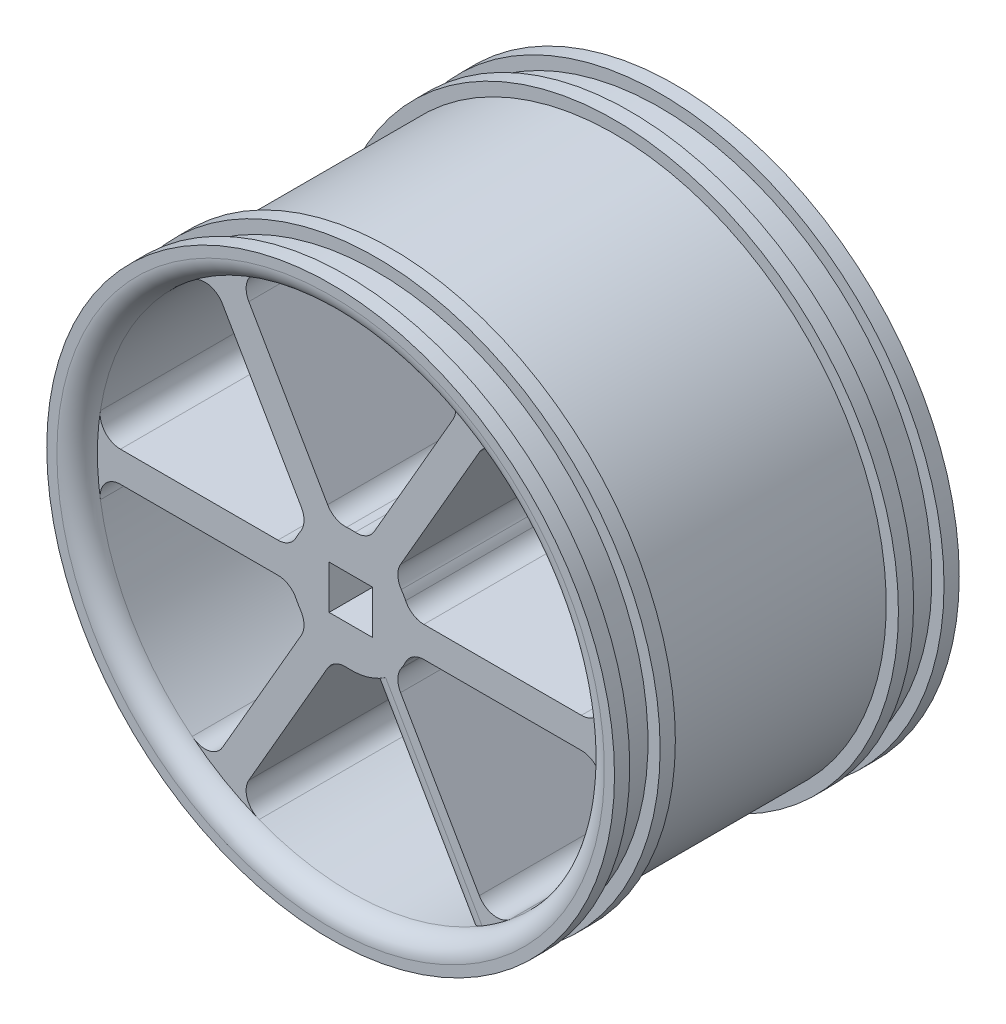
from build123d import *

# Parameters (mm, degrees)
SKETCH2_W           = 25
SKETCH2_H           = 3
BOSS_EXTRUDE1_DEPTH = 32
CIRPATTERN1_COUNT   = 6
SKETCH5_R           = 6
BOSS_EXTRUDE2_DEPTH = 32
SKETCH6_W           = 4.3
SKETCH6_H           = 4.3
AXLEHOLE_DEPTH      = 53.191951405
FILLET1_R           = 2


with BuildPart() as part:
    # Sketch1 → Revolve1 (revolve)
    with BuildSketch(Plane.XZ, mode=Mode.PRIVATE) as revolve1_sk:
        with BuildLine():
            Line((25, 0), (28, 0))
            Line((28, 0), (28, 1.5))
            Line((28, 1.5), (26.8, 1.5))
            Line((26.8, 1.5), (26.8, 4.5))
            Line((26.8, 4.5), (28, 4.5))
            Line((28, 4.5), (28, 6))
            Line((28, 6), (26.8, 6))
            Line((26.8, 6), (26.8, 28))
            Line((26.8, 28), (28, 28))
            Line((28, 28), (28, 29.5))
            Line((28, 29.5), (26.8, 29.5))
            Line((26.8, 29.5), (26.8, 32.5))
            Line((26.8, 32.5), (28, 32.5))
            Line((28, 32.5), (28, 33.999996833))
            Line((28, 33.999996833), (27, 33.999996833))
            ThreePointArc((27, 33.999996833), (25.585786438, 33.414213562), (25, 32))
            Line((25, 32), (25, 0))
        make_face()
    revolve(revolve1_sk.sketch.rotate(Axis((0, 0, 34), (0, 0, -1)), 180), axis=Axis((0, 0, 34), (0, 0, -1)))

    # Sketch2 → Boss-Extrude1 (add)
    with BuildSketch(Plane.XY):
        with Locations((12.5, 0)):
            Rectangle(SKETCH2_W, SKETCH2_H)
    boss_extrude1 = extrude(amount=BOSS_EXTRUDE1_DEPTH)

    # CirPattern1: Boss-Extrude1 ×6 about axis
    cirpattern1_axis = Axis((0, 0, 0), (0, 0, 1))
    for i in range(1, CIRPATTERN1_COUNT):
        add(boss_extrude1.rotate(cirpattern1_axis, i * 360 / CIRPATTERN1_COUNT))

    # Sketch5 → Boss-Extrude2 (add)
    with BuildSketch(Plane.XY):
        Circle(SKETCH5_R)
    extrude(amount=BOSS_EXTRUDE2_DEPTH)

    # Sketch6 → AxleHole (cut, through all)
    with BuildSketch(Plane.XY):
        Rectangle(SKETCH6_W, SKETCH6_H)
    extrude(amount=AXLEHOLE_DEPTH, mode=Mode.SUBTRACT)

    # Fillet1
    # the kernel refuses this fillet: 2 mm, written as the material it adds along each edge
    with BuildSketch(Plane(origin=(-24.954959427, -1.5, 32), x_dir=(0.10620109039764976, -0.9943446728365121, 0), z_dir=(0, 0, -1))) as fillet1_piece_1:
        with BuildLine():
            CenterArc((2.224755634, -1.997850608), FILLET1_R, 87.343441845, 98.752929077)
            Line((0.236066288, -2.210252789), (0, 0))
            ThreePointArc((0, 0), (1.158726893, 0.026867397), (2.317453785, 0))
        make_face()
    extrude(amount=32)
    with BuildSketch(Plane(origin=(-13.776517819, -20.861628814, 32), x_dir=(-0.8080272015953212, 0.589145178612228, 0), z_dir=(0, 0, -1)), Plane(origin=(13.776517819, 20.861628814, 32), x_dir=(0.8080272015953204, -0.589145178612229, 0), z_dir=(0, 0, -1)), Plane(origin=(24.954959427, -1.5, 32), x_dir=(-0.10620109039765001, -0.994344672836512, 0), z_dir=(0, 0, -1)), Plane(origin=(-11.178441608, 22.361628814, 32), x_dir=(0.9142282919929712, 0.405199494224283, 0), z_dir=(0, 0, -1)), Plane(origin=(-24.954959427, 1.5, 32), x_dir=(0.10620109039765026, 0.994344672836512, 0), z_dir=(0, 0, -1))) as fillet1_piece_2:
        with BuildLine():
            CenterArc((2.224755634, 1.997850608), FILLET1_R, 173.903629078, 98.752929077)
            Line((0.236066288, 2.210252789), (0, 0))
            ThreePointArc((0, 0), (1.158726893, -0.026867397), (2.317453785, 0))
        make_face()
    extrude(amount=32)
    with BuildSketch(Plane(origin=(-11.178441608, -22.361628814, 32), x_dir=(0.4999999999999988, 0.8660254037844393, 0), z_dir=(0, 0, -1)), Plane(origin=(13.776517819, -20.861628814, 32), x_dir=(-0.500000000000002, 0.8660254037844375, 0), z_dir=(0, 0, -1)), Plane(origin=(24.954959427, 1.5, 32), x_dir=(-1, 0, 0), z_dir=(0, 0, -1)), Plane(origin=(11.178441608, 22.361628814, 32), x_dir=(-0.5000000000000002, -0.8660254037844387, 0), z_dir=(0, 0, -1)), Plane(origin=(-13.776517819, 20.861628814, 32), x_dir=(0.5000000000000002, -0.8660254037844387, 0), z_dir=(0, 0, -1))) as fillet1_piece_3:
        with BuildLine():
            CenterArc((2.222823584, 2), FILLET1_R, 171.247070923, 98.752929077)
            ThreePointArc((0.246116119, 2.304347826), (0.096342606, 1.15502726), (0, 0))
            Line((0, 0), (2.222823584, 0))
        make_face()
    extrude(amount=32)
    with BuildSketch(Plane(origin=(5.809475019, 1.5, 32), x_dir=(1, 0, 0), z_dir=(0, 0, -1)), Plane(origin=(4.203775615, -4.281152949, 32), x_dir=(0.5000000000000001, -0.8660254037844386, 0), z_dir=(0, 0, -1)), Plane(origin=(1.605699404, 5.781152949, 32), x_dir=(0.4999999999999986, 0.8660254037844394, 0), z_dir=(0, 0, -1)), Plane(origin=(-4.203775615, 4.281152949, 32), x_dir=(-0.5000000000000004, 0.8660254037844384, 0), z_dir=(0, 0, -1)), Plane(origin=(-5.809475019, -1.5, 32), x_dir=(-1, 0, 0), z_dir=(0, 0, -1)), Plane(origin=(-1.605699404, -5.781152949, 32), x_dir=(-0.4999999999999988, -0.8660254037844393, 0), z_dir=(0, 0, -1))) as fillet1_piece_4:
        with BuildLine():
            CenterArc((1.384272266, -2), FILLET1_R, 90, 64.055520228)
            ThreePointArc((-0.414164556, -1.125), (-0.178914596, -0.572869827), (0, 0))
            Line((0, 0), (1.384272266, 0))
        make_face()
    extrude(amount=32)
    with BuildSketch(Plane(origin=(4.203775615, 4.281152949, 32), x_dir=(0.6399622417657335, -0.7684063567632539, 0), z_dir=(0, 0, -1)), Plane(origin=(5.809475019, -1.5, 32), x_dir=(-0.3454783045035584, -0.9384267372135913, 0), z_dir=(0, 0, -1)), Plane(origin=(-1.605699404, 5.781152949, 32), x_dir=(0.9854405462692932, 0.1700203804503366, 0), z_dir=(0, 0, -1)), Plane(origin=(-5.809475019, 1.5, 32), x_dir=(0.3454783045035597, 0.9384267372135907, 0), z_dir=(0, 0, -1))) as fillet1_piece_5:
        with BuildLine():
            CenterArc((1.398617439, -1.989994715), FILLET1_R, 95.733483793, 64.055520228)
            Line((-0.478236035, -1.299038106), (0, 0))
            ThreePointArc((0, 0), (0.599407474, -0.030015856), (1.198814948, 0))
        make_face()
    extrude(amount=32)
    with BuildSketch(Plane(origin=(-4.203775615, -4.281152949, 32), x_dir=(-0.4999999999999996, -0.8660254037844388, 0), z_dir=(0, 0, -1))) as fillet1_piece_6:
        with BuildLine():
            CenterArc((1.384272266, 2), FILLET1_R, 205.944479772, 64.055520228)
            ThreePointArc((-0.414164556, 1.125), (-0.178914596, 0.572869827), (0, 0))
            Line((0, 0), (1.384272266, 0))
        make_face()
    extrude(amount=32)
    # the kernel refuses this fillet: 2 mm, written as the material it takes off along each edge
    with BuildSketch(Plane(origin=(-0.894300596, -1.45102593, 32), x_dir=(0.8660254037844386, 0.5000000000000003, 0), z_dir=(0.5000000000000003, -0.8660254037844386, 0))) as fillet1_2_piece_1_section:
        with BuildLine():
            CenterArc((FILLET1_R, -FILLET1_R), FILLET1_R, 90, 90)
            Line((0, -FILLET1_R), (0, 0))
            Line((0, 0), (FILLET1_R, 0))
        make_face()
    fillet1_2_piece_1 = extrude(amount=29.145484408, mode=Mode.PRIVATE)
    fillet1_2_piece_1 = fillet1_2_piece_1 & Plane(origin=(0, 0, 32), x_dir=(-1, 0, 0), z_dir=(0, 0, -1)) * Cylinder(25, 67, mode=Mode.PRIVATE)
    fillet1_2_piece_1 = fillet1_2_piece_1 - Plane(origin=(0, 0, 32), x_dir=(1, 0, 0), z_dir=(0, 0, -1)) * Cylinder(6, 67, mode=Mode.PRIVATE)
    add(fillet1_2_piece_1, mode=Mode.SUBTRACT)


solid = part.part
